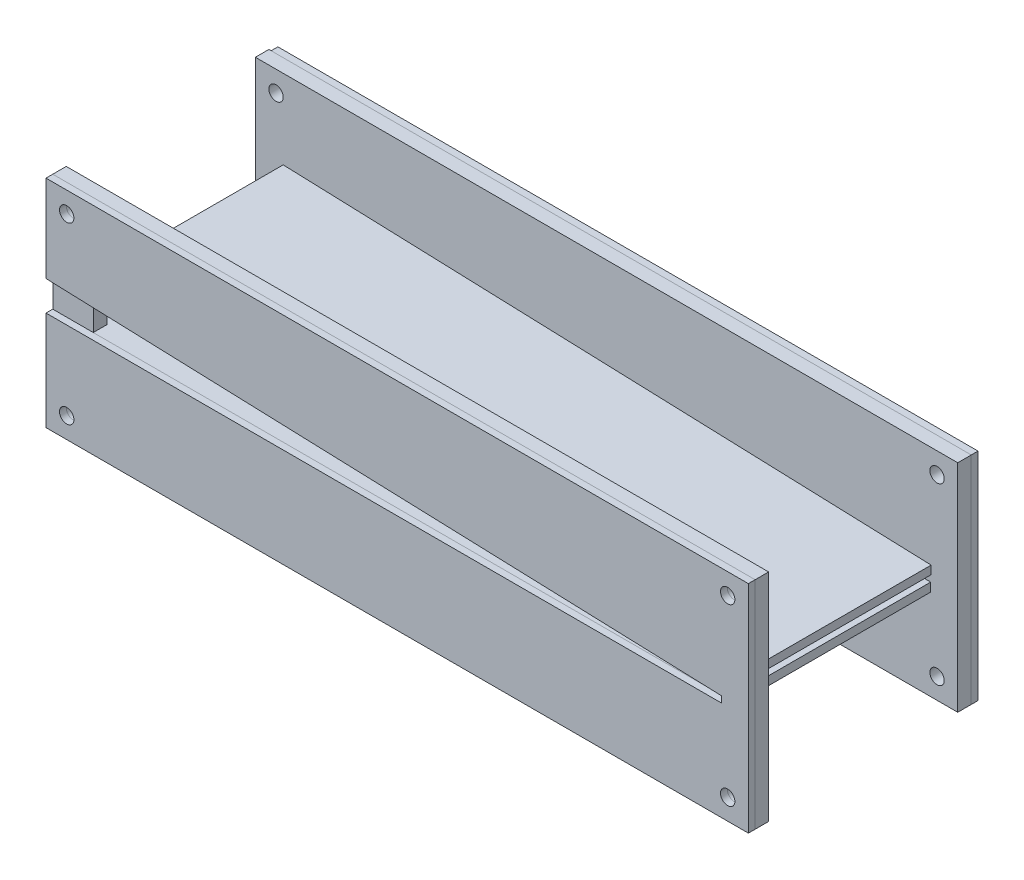
from build123d import *

# Parameters (mm, degrees)
SKETCH1_W               = 330.2
SKETCH1_H               = 101.6
BOSS_EXTRUDE1_DEPTH     = 3.175
BOSS_EXTRUDE3_DEPTH     = 3.175
BOSS_EXTRUDE4_DEPTH     = 101.6
SKETCH3_W               = 304.8
SKETCH3_H               = 4.064
BOSS_EXTRUDE4_2_DEPTH   = 101.6
MIRROR2_START           = -98.425
MIRROR2_OUTLINE_W       = 330.2
MIRROR2_OUTLINE_H       = 101.6
MIRROR2_DEPTH           = 6.35
SKETCH7_W               = 329.139579846
SKETCH7_H               = 101.6
BOSS_EXTRUDE6_DEPTH     = 3.175
CUT_EXTRUDE1_START      = -163.576
SKETCH6_R               = 3.3782
CUT_EXTRUDE1_DEPTH      = 368.271489641
MIRROR4_START           = -163.576
MIRROR4_COPY_1_SKETCH_R = 3.3782
MIRROR4_COPY_1_DEPTH    = 368.271489641


# Read off the part's stored shape, not the designer's step: Mirror2
with BuildPart() as part:
    # Sketch1 → Boss-Extrude1 (new body)
    with BuildSketch(Plane.XY):
        Rectangle(SKETCH1_W, SKETCH1_H)
        Polygon((152.593417321, 2.878595484), (-152.020906755, 13.515962079), (-152.16273831, 9.454437758), (-145.816606558, 9.232825954), (-146.05, -4.138275386), (-152.4, -4.138275386), (-152.4, -8.202275386), (152.4, -8.202275386), (152.4, -4.138275386), (146.119970101, -4.138275386), (146.175381491, -0.963758954), (152.451585766, -1.182928837), align=None, mode=Mode.SUBTRACT)
    boss_extrude1 = extrude(amount=BOSS_EXTRUDE1_DEPTH)

    # Mirror1: Boss-Extrude1 across Front Plane
    add(boss_extrude1.mirror(Plane.XY))


with BuildPart() as body_2:
    # Sketch2 → Boss-Extrude3 (new body)
    with BuildSketch(Plane.XY.offset(3.175)):
        Polygon((-165.1, 9.906216891), (152.451585766, -1.182928837), (152.4, -4.138275386), (-165.1, -4.138275386), (-165.1, -50.8), (165.1, -50.8), (165.1, 50.8), (-165.1, 50.8), align=None)
    extrude(amount=BOSS_EXTRUDE3_DEPTH)


with BuildPart() as body_3:
    # Sketch3 → Boss-Extrude4 (new body)
    with BuildSketch(Plane(origin=(0, 0, 3.175), x_dir=(-1, 0, 0), z_dir=(0, 0, -1))):
        Polygon((-152.593417321, 2.878595484), (-152.451585766, -1.182928837), (152.16273831, 9.454437758), (152.020906755, 13.515962079), align=None)
    extrude(amount=BOSS_EXTRUDE4_DEPTH)


with BuildPart() as body_4:
    # Sketch3 → Boss-Extrude4 2 (new body)
    with BuildSketch(Plane(origin=(0, 0, 3.175), x_dir=(-1, 0, 0), z_dir=(0, 0, -1))):
        with Locations((0, -6.170275386)):
            Rectangle(SKETCH3_W, SKETCH3_H)
    extrude(amount=BOSS_EXTRUDE4_2_DEPTH)


with BuildPart() as body_5:
    # Mirror2 outline → Mirror2 (new body)
    with BuildSketch(Plane.XY.offset(MIRROR2_START)):
        Rectangle(MIRROR2_OUTLINE_W, MIRROR2_OUTLINE_H)
        Polygon((-152.020906755, 13.515962079), (152.593417321, 2.878595484), (152.451585766, -1.182928837), (146.175381491, -0.963758954), (146.119970101, -4.138275386), (152.4, -4.138275386), (152.4, -8.202275386), (-152.4, -8.202275386), (-152.4, -4.138275386), (-146.05, -4.138275386), (-145.816606558, 9.232825954), (-152.16273831, 9.454437758), align=None, mode=Mode.SUBTRACT)
    extrude(amount=MIRROR2_DEPTH)


with BuildPart() as body_6:
    # Sketch7 → Boss-Extrude6 (new body)
    with BuildSketch(Plane(origin=(0, 0, -98.425), x_dir=(-1, 0, 0), z_dir=(0, 0, -1))):
        with Locations((-0.530210077, 0)):
            Rectangle(SKETCH7_W, SKETCH7_H)
    extrude(amount=BOSS_EXTRUDE6_DEPTH)


with BuildPart() as cut_extrude1_tool:
    # Sketch6 → Cut-Extrude1 (new body)
    with BuildSketch(Plane(origin=(0, 0, -101.6), x_dir=(-1, 0, 0), z_dir=(0, 0, -1)).offset(CUT_EXTRUDE1_START)):
        with Locations(Location((-155.3718, 41.0718, 0), (0, 0, 180))):
            Circle(SKETCH6_R)
    cut_extrude1 = extrude(amount=CUT_EXTRUDE1_DEPTH)


with BuildPart() as part_1:
    add(part.part)

    # Cut-Extrude1: cut by cut_extrude1_tool
    add(cut_extrude1_tool.part, mode=Mode.SUBTRACT)


with BuildPart() as body_2_1:
    add(body_2.part)

    # Cut-Extrude1: cut by cut_extrude1_tool
    add(cut_extrude1_tool.part, mode=Mode.SUBTRACT)


with BuildPart() as body_5_1:
    add(body_5.part)

    # Cut-Extrude1: cut by cut_extrude1_tool
    add(cut_extrude1_tool.part, mode=Mode.SUBTRACT)


with BuildPart() as body_6_1:
    add(body_6.part)

    # Cut-Extrude1: cut by cut_extrude1_tool
    add(cut_extrude1_tool.part, mode=Mode.SUBTRACT)


with BuildPart() as mirror3_tool:
    # Mirror3: Cut-Extrude1 across plane
    add(cut_extrude1.mirror(Plane(origin=(0, 0, 0), x_dir=(0, 0, 1), z_dir=(1, 0, 0))))


with BuildPart() as part_2:
    add(part_1.part)

    # Mirror3: cut by mirror3_tool
    add(mirror3_tool.part, mode=Mode.SUBTRACT)


with BuildPart() as body_2_2:
    add(body_2_1.part)

    # Mirror3: cut by mirror3_tool
    add(mirror3_tool.part, mode=Mode.SUBTRACT)


with BuildPart() as body_5_2:
    add(body_5_1.part)

    # Mirror3: cut by mirror3_tool
    add(mirror3_tool.part, mode=Mode.SUBTRACT)


with BuildPart() as body_6_2:
    add(body_6_1.part)

    # Mirror3: cut by mirror3_tool
    add(mirror3_tool.part, mode=Mode.SUBTRACT)


with BuildPart() as mirror4_tool:
    # Mirror4: Cut-Extrude1 across plane
    add(cut_extrude1.mirror(Plane.ZX))


with BuildPart() as part_3:
    add(part_2.part)

    # Mirror4: cut by mirror4_tool
    add(mirror4_tool.part, mode=Mode.SUBTRACT)


with BuildPart() as body_2_3:
    add(body_2_2.part)

    # Mirror4: cut by mirror4_tool
    add(mirror4_tool.part, mode=Mode.SUBTRACT)


with BuildPart() as body_5_3:
    add(body_5_2.part)

    # Mirror4: cut by mirror4_tool
    add(mirror4_tool.part, mode=Mode.SUBTRACT)


with BuildPart() as body_6_3:
    add(body_6_2.part)

    # Mirror4: cut by mirror4_tool
    add(mirror4_tool.part, mode=Mode.SUBTRACT)


with BuildPart() as mirror4_copy_1_tool:
    # Mirror4 copy 1 sketch → Mirror4 copy 1 (new body)
    with BuildSketch(Plane(origin=(0, 0, -101.6), x_dir=(1, 0, 0), z_dir=(0, 0, -1)).offset(MIRROR4_START)):
        with Locations(Location((-155.3718, 41.0718, 0), (0, 0, 180))):
            Circle(MIRROR4_COPY_1_SKETCH_R)
    extrude(amount=MIRROR4_COPY_1_DEPTH)


with BuildPart() as part_4:
    add(part_3.part)

    # Mirror4 copy 1: cut by mirror4_copy_1_tool
    add(mirror4_copy_1_tool.part, mode=Mode.SUBTRACT)


with BuildPart() as body_2_4:
    add(body_2_3.part)

    # Mirror4 copy 1: cut by mirror4_copy_1_tool
    add(mirror4_copy_1_tool.part, mode=Mode.SUBTRACT)


with BuildPart() as body_5_4:
    add(body_5_3.part)

    # Mirror4 copy 1: cut by mirror4_copy_1_tool
    add(mirror4_copy_1_tool.part, mode=Mode.SUBTRACT)


with BuildPart() as body_6_4:
    add(body_6_3.part)

    # Mirror4 copy 1: cut by mirror4_copy_1_tool
    add(mirror4_copy_1_tool.part, mode=Mode.SUBTRACT)


solid = Compound([body_3.part, body_4.part, part_4.part, body_2_4.part, body_5_4.part, body_6_4.part])
